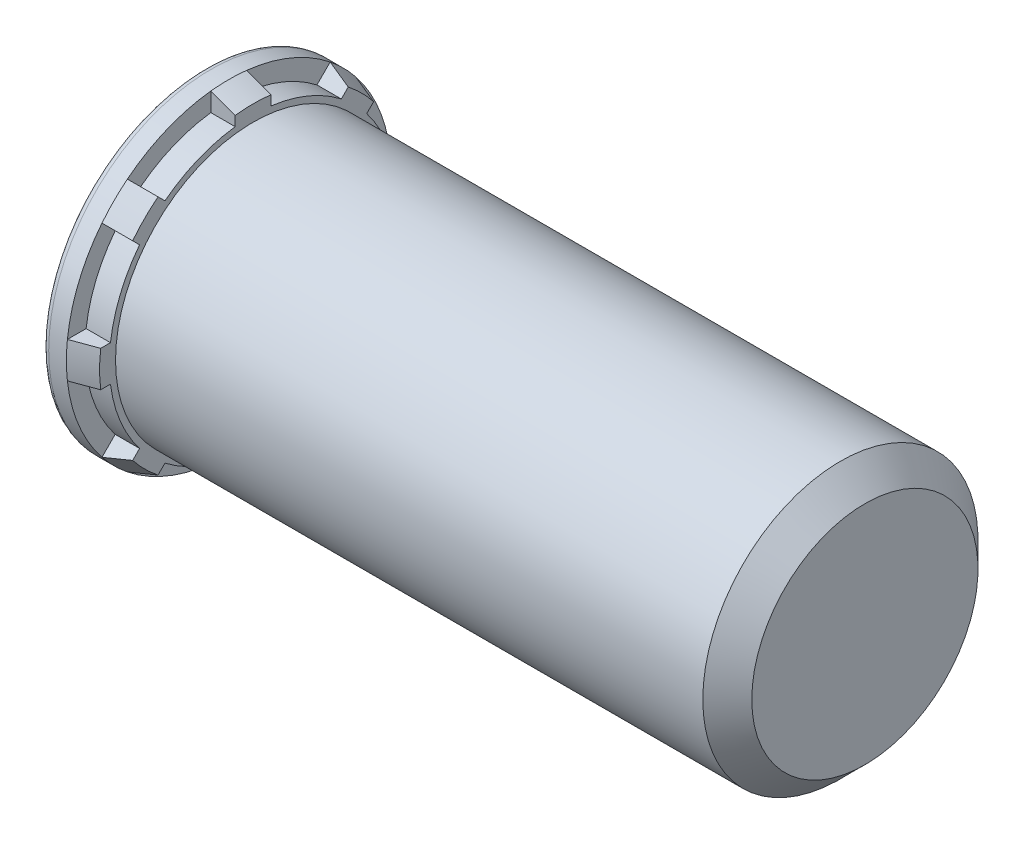
from build123d import *

# Parameters (mm, degrees)
RIBCUT_START     = -0.4425
RIBCUT_DEPTH     = 0.4425
RIBCUTSPAT_COUNT = 8
RIBCUTSPAT_ANGLE = 315


with BuildPart() as part:
    # BodySke → BaseBody (revolve)
    with BuildSketch(Plane.XY):
        with BuildLine():
            Line((-0.4425, 2.82946), (-0.4425, 0))
            Line((-0.4425, 0), (11.5575, 0))
            Line((11.5575, 0), (11.5575, 2.055))
            Line((11.5575, 2.055), (11.1125, 2.5))
            Line((11.1125, 2.5), (0.4425, 2.5))
            Line((0.4425, 2.5), (0.4425, 2.788943171))
            Line((0.4425, 2.788943171), (0, 2.95))
            Line((0, 2.95), (-0.32196, 2.95))
            ThreePointArc((-0.32196, 2.95), (-0.4053986, 2.9154386), (-0.43996, 2.832))
            Line((-0.43996, 2.832), (-0.43996, 2.82946))
            Line((-0.43996, 2.82946), (-0.4425, 2.82946))
        make_face()
    revolve(axis=Axis((0, 0, 0), (1, 0, 0)))

    # RibCutSke → RibCut (cut)
    with BuildSketch(Plane(origin=(0.4425, 1.794401132, -0.090952894), x_dir=(0, 0, -1), z_dir=(1, 0, 0)).offset(RIBCUT_START)):
        with BuildLine():
            Line((0.235362586, 0.797639465), (0.235362586, 1.137495559))
            ThreePointArc((0.235362586, 1.137495559), (1.037963231, 0.931043489), (1.751471249, 0.509502789))
            Line((1.751471249, 0.509502789), (1.5111567, 0.26918824))
            ThreePointArc((1.5111567, 0.26918824), (0.908807573, 0.619234146), (0.235362586, 0.797639465))
        make_face()
    ribcut = extrude(amount=RIBCUT_DEPTH, mode=Mode.SUBTRACT)

    # RibCutsPat: RibCut ×8 about axis
    ribcutspat_axis = Axis((0, 0, 0), (1, 0, 0))
    for i in range(1, RIBCUTSPAT_COUNT):
        add(ribcut.rotate(ribcutspat_axis, i * RIBCUTSPAT_ANGLE / (RIBCUTSPAT_COUNT - 1)), mode=Mode.SUBTRACT)


solid = part.part
